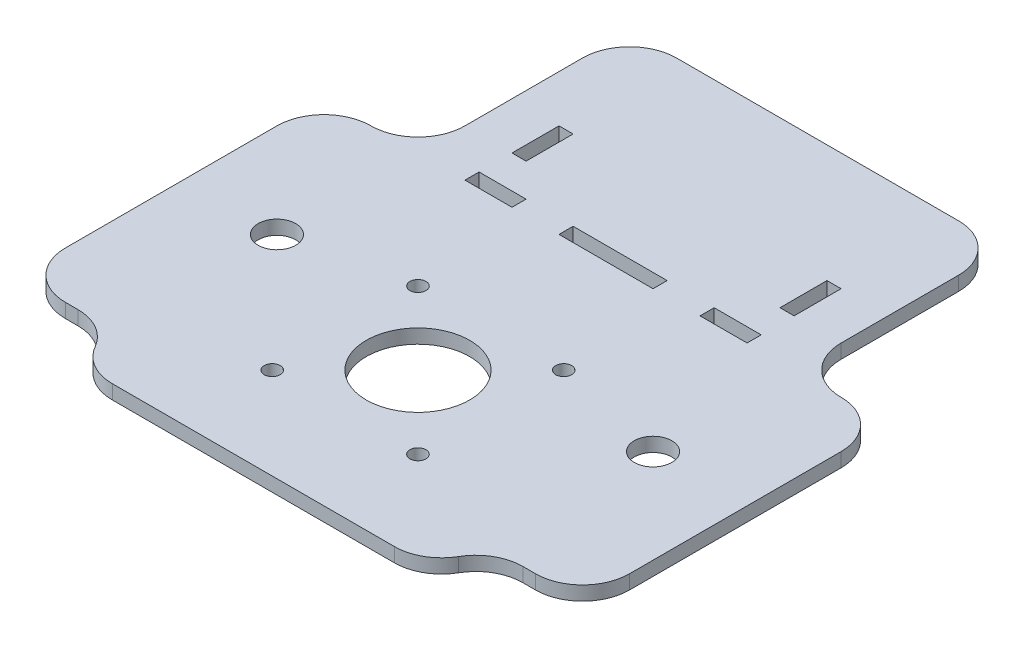
from build123d import *

# Parameters (mm, degrees)
SKETCH1_W           = 60
SKETCH1_H           = 90
BOSS_EXTRUDE1_DEPTH = 3
SKETCH2_W           = 10
SKETCH2_H           = 3
SKETCH2_W_2         = 3
SKETCH2_H_2         = 10
SKETCH2_W_3         = 20
CUT_EXTRUDE2_DEPTH  = 3
SKETCH3_W           = 80
SKETCH3_H           = 120
BOSS_EXTRUDE2_DEPTH = 3
FILLET1_R           = 10
FILLET2_R           = 10
SKETCH4_R           = 1.7
CUT_EXTRUDE3_DEPTH  = 3
SKETCH5_R           = 11
CUT_EXTRUDE4_DEPTH  = 3
SKETCH6_W           = 20
SKETCH6_H           = 65
BOSS_EXTRUDE3_DEPTH = 3
FILLET3_R           = 10
SKETCH7_R           = 4
CUT_EXTRUDE5_DEPTH  = 3


with BuildPart() as part:
    # Sketch1 → Boss-Extrude1 (new body)
    with BuildSketch(Plane(origin=(0, 0, 0), x_dir=(1, 0, 0), z_dir=(0, 1, 0))):
        Rectangle(SKETCH1_W, SKETCH1_H)
    extrude(amount=BOSS_EXTRUDE1_DEPTH)

    # Sketch2 → Cut-Extrude2 (cut)
    with BuildSketch(Plane(origin=(0, 3, 0), x_dir=(1, 0, 0), z_dir=(0, 1, 0))):
        with Locations((25, 16.5)):
            Rectangle(SKETCH2_W, SKETCH2_H)
        with Locations((-28.5, 30)):
            Rectangle(SKETCH2_W_2, SKETCH2_H_2)
        with Locations((-25, 16.5)):
            Rectangle(SKETCH2_W, SKETCH2_H)
        with Locations((0, 16.5)):
            Rectangle(SKETCH2_W_3, SKETCH2_H)
        with Locations((28.5, 30)):
            Rectangle(SKETCH2_W_2, SKETCH2_H_2)
    extrude(amount=-CUT_EXTRUDE2_DEPTH, mode=Mode.SUBTRACT)

    # Sketch3 → Boss-Extrude2 (add)
    with BuildSketch(Plane(origin=(0, 3, 0), x_dir=(1, 0, 0), z_dir=(0, 1, 0))):
        Rectangle(SKETCH3_W, SKETCH3_H)
        Polygon((-30, 18), (-30, -45), (30, -45), (30, 18), (30, 25), (30, 45), (-30, 45), (-30, 35), align=None, mode=Mode.SUBTRACT)
    extrude(amount=-BOSS_EXTRUDE2_DEPTH)

    # Fillet1
    fillet1_edges = [part.edges().sort_by_distance(p)[0] for p in [
        (-40, 1.5, 60),
        (40, 1.5, 60),
    ]]
    fillet(fillet1_edges, radius=FILLET1_R)

    # Fillet2
    fillet2_edges = [part.edges().sort_by_distance(p)[0] for p in [
        (-40, 1.5, -60),
        (40, 1.5, -60),
    ]]
    fillet(fillet2_edges, radius=FILLET2_R)

    # Sketch4 → Cut-Extrude3 (cut)
    with BuildSketch(Plane(origin=(0, 3, 0), x_dir=(1, 0, 0), z_dir=(0, 1, 0))):
        with Locations(Location((15.5, -9.5, 0), (0, 0, 270))):
            Circle(SKETCH4_R)
        with Locations(Location((15.5, -40.5, 0), (0, 0, 270))):
            Circle(SKETCH4_R)
        with Locations(Location((-15.5, -40.5, 0), (0, 0, 270))):
            Circle(SKETCH4_R)
        with Locations(Location((-15.5, -9.5, 0), (0, 0, 270))):
            Circle(SKETCH4_R)
    extrude(amount=-CUT_EXTRUDE3_DEPTH, mode=Mode.SUBTRACT)

    # Sketch5 → Cut-Extrude4 (cut)
    with BuildSketch(Plane(origin=(0, 3, 0), x_dir=(1, 0, 0), z_dir=(0, 1, 0))):
        with Locations(Location((0, -25, 0), (0, 0, 270))):
            Circle(SKETCH5_R)
    extrude(amount=-CUT_EXTRUDE4_DEPTH, mode=Mode.SUBTRACT)

    # Sketch6 → Boss-Extrude3 (add)
    with BuildSketch(Plane(origin=(0, 3, 0), x_dir=(1, 0, 0), z_dir=(0, 1, 0))):
        with Locations((50, -17.5)):
            Rectangle(SKETCH6_W, SKETCH6_H)
        with Locations((-50, -17.5)):
            Rectangle(SKETCH6_W, SKETCH6_H)
    extrude(amount=-BOSS_EXTRUDE3_DEPTH)

    # Fillet3
    fillet3_edges = [part.edges().sort_by_distance(p)[0] for p in [
        (-40, 1.5, 50),
        (-60, 1.5, 50),
        (-40, 1.5, -15),
        (-60, 1.5, -15),
        (40, 1.5, -15),
        (60, 1.5, -15),
        (60, 1.5, 50),
        (40, 1.5, 50),
    ]]
    fillet(fillet3_edges, radius=FILLET3_R - 0.0001)  # a hair under: the kernel refuses the full size

    # Sketch7 → Cut-Extrude5 (cut)
    with BuildSketch(Plane(origin=(0, 3, 0), x_dir=(1, 0, 0), z_dir=(0, 1, 0))):
        with Locations(Location((-40, -15, 0), (0, 0, 270))):
            Circle(SKETCH7_R)
        with Locations(Location((40, -15, 0), (0, 0, 270))):
            Circle(SKETCH7_R)
    extrude(amount=-CUT_EXTRUDE5_DEPTH, mode=Mode.SUBTRACT)


solid = part.part
